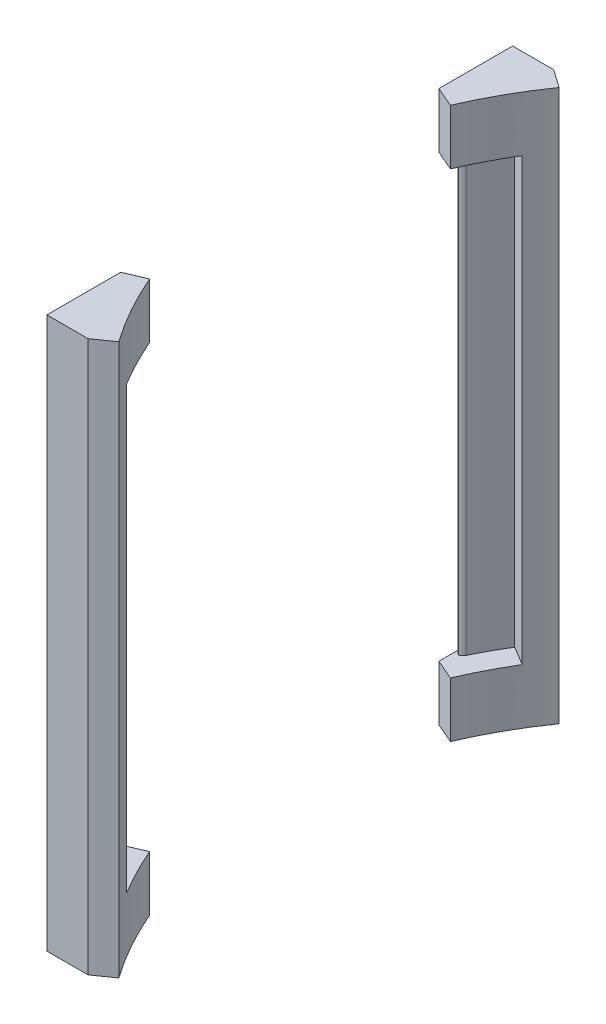
from build123d import *

# Parameters (mm, degrees)
BOSS_EXTRUDE1_DEPTH   = 37.5
BOSS_EXTRUDE1_2_DEPTH = 37.5
CUT_EXTRUDE1_START    = -30
CUT_EXTRUDE1_DEPTH    = 60
SKETCH2_W             = 47.307139372
SKETCH2_H             = 60
CUT_EXTRUDE2_DEPTH    = 10
FILLET1_R             = 1
FILLET2_R             = 1


# Read off the part's stored shape, not the designer's step: Cut-Extrude1
with BuildPart() as part:
    # Sketch1 → Boss-Extrude1 (new, symmetric)
    with BuildSketch(Plane(origin=(0, 0, 0), x_dir=(1, 0, 0), z_dir=(0, 1, 0))):
        with BuildLine():
            Line((-50.558114283, 21.653569686), (-47.800398958, 20.472465885))
            ThreePointArc((-47.800398958, 20.472465885), (-45.398587973, 25.356817822), (-42.499380558, 29.963355156))
            Line((-42.499380558, 29.963355156), (-44.951267898, 31.692010261))
            Line((-44.951267898, 31.692010261), (-50.558114283, 31.692010261))
            Line((-50.558114283, 31.692010261), (-50.558114283, 21.653569686))
        make_face()
    extrude(amount=BOSS_EXTRUDE1_DEPTH, both=True)


with BuildPart() as body_2:
    # Sketch1 → Boss-Extrude1 2 (new, symmetric)
    with BuildSketch(Plane(origin=(0, 0, 0), x_dir=(1, 0, 0), z_dir=(0, 1, 0))):
        with BuildLine():
            Line((-47.800398958, -20.472465885), (-50.558114283, -21.653569686))
            Line((-50.558114283, -21.653569686), (-50.558114283, -31.692010261))
            Line((-50.558114283, -31.692010261), (-44.951267898, -31.692010261))
            Line((-44.951267898, -31.692010261), (-42.499380558, -29.963355156))
            ThreePointArc((-42.499380558, -29.963355156), (-45.398587973, -25.356817822), (-47.800398958, -20.472465885))
        make_face()
    extrude(amount=BOSS_EXTRUDE1_2_DEPTH, both=True)


with BuildPart() as cut_extrude1_tool:
    # Cut-Extrude1 outline → Cut-Extrude1 (new body)
    with BuildSketch(Plane(origin=(0, 0, 0), x_dir=(1, 0, 0), z_dir=(0, 1, 0)).offset(CUT_EXTRUDE1_START)):
        with BuildLine():
            Line((-44.4859922, 26.925759005), (-47.05249175, 28.479168178))
            ThreePointArc((-47.05249175, 28.479168178), (-48.924480592, 25.12757845), (-50.558114283, 21.653569686))
            Line((-50.558114283, 21.653569686), (-47.800398958, 20.472465885))
            ThreePointArc((-47.800398958, 20.472465885), (-46.25587256, 23.756983262), (-44.4859922, 26.925759005))
        make_face()
        with BuildLine():
            Line((-47.800398958, -20.472465885), (-50.558114283, -21.653569686))
            ThreePointArc((-50.558114283, -21.653569686), (-48.924480592, -25.12757845), (-47.05249175, -28.479168178))
            Line((-47.05249175, -28.479168178), (-44.4859922, -26.925759005))
            ThreePointArc((-44.4859922, -26.925759005), (-46.25587256, -23.756983262), (-47.800398958, -20.472465885))
        make_face()
    extrude(amount=CUT_EXTRUDE1_DEPTH)


with BuildPart() as part_1:
    add(part.part)

    # Cut-Extrude1: cut by cut_extrude1_tool
    add(cut_extrude1_tool.part, mode=Mode.SUBTRACT)


with BuildPart() as body_2_1:
    add(body_2.part)

    # Cut-Extrude1: cut by cut_extrude1_tool
    add(cut_extrude1_tool.part, mode=Mode.SUBTRACT)


with BuildPart() as cut_extrude2_tool:
    # Sketch2 → Cut-Extrude2 (new body)
    with BuildSketch(Plane.ZY.offset(50.558114283)):
        Rectangle(SKETCH2_W, SKETCH2_H)
    extrude(amount=-CUT_EXTRUDE2_DEPTH)


with BuildPart() as part_2:
    add(part_1.part)

    # Cut-Extrude2: cut by cut_extrude2_tool
    add(cut_extrude2_tool.part, mode=Mode.SUBTRACT)

    # Fillet1
    # the kernel refuses this fillet: 1 mm, written as the material it takes off along each edge
    with BuildSketch(Plane(origin=(-49.653888479, 30, -23.653569686), x_dir=(-1, 0, 0), z_dir=(0, -1, 0))) as fillet1_piece_1:
        with BuildLine():
            CenterArc((0.627335668, 1), FILLET1_R, 206.119342863, 63.880657137)
            ThreePointArc((-0.270543335, 0.559757684), (-0.134480737, 0.280261116), (0, 0))
            Line((0, 0), (0.627335668, 0))
        make_face()
    extrude(amount=60, mode=Mode.SUBTRACT)
    with BuildSketch(Plane(origin=(-50.558114283, 30, -23.653569686), x_dir=(1, 0, 0), z_dir=(0, -1, 0))) as fillet1_piece_2:
        with BuildLine():
            CenterArc((FILLET1_R, -FILLET1_R), FILLET1_R, 90, 90)
            Line((0, -FILLET1_R), (0, 0))
            Line((0, 0), (FILLET1_R, 0))
        make_face()
    extrude(amount=60, mode=Mode.SUBTRACT)


with BuildPart() as body_2_2:
    add(body_2_1.part)

    # Cut-Extrude2: cut by cut_extrude2_tool
    add(cut_extrude2_tool.part, mode=Mode.SUBTRACT)

    # Fillet2
    # the kernel refuses this fillet: 1 mm, written as the material it takes off along each edge
    with BuildSketch(Plane(origin=(-50.558114283, -30, 23.653569686), x_dir=(0, 0, 1), z_dir=(0, 1, 0))) as fillet2_piece_1:
        with BuildLine():
            CenterArc((FILLET2_R, FILLET2_R), FILLET2_R, 180, 90)
            Line((0, FILLET2_R), (0, 0))
            Line((0, 0), (FILLET2_R, 0))
        make_face()
    extrude(amount=60, mode=Mode.SUBTRACT)
    with BuildSketch(Plane(origin=(-49.653888479, 30, 23.653569686), x_dir=(-1, 0, 0), z_dir=(0, -1, 0))) as fillet2_piece_2:
        with BuildLine():
            CenterArc((0.627335668, -1), FILLET2_R, 90, 63.880657137)
            ThreePointArc((-0.270543335, -0.559757684), (-0.134480737, -0.280261116), (0, 0))
            Line((0, 0), (0.627335668, 0))
        make_face()
    extrude(amount=60, mode=Mode.SUBTRACT)


solid = Compound([part_2.part, body_2_2.part])
